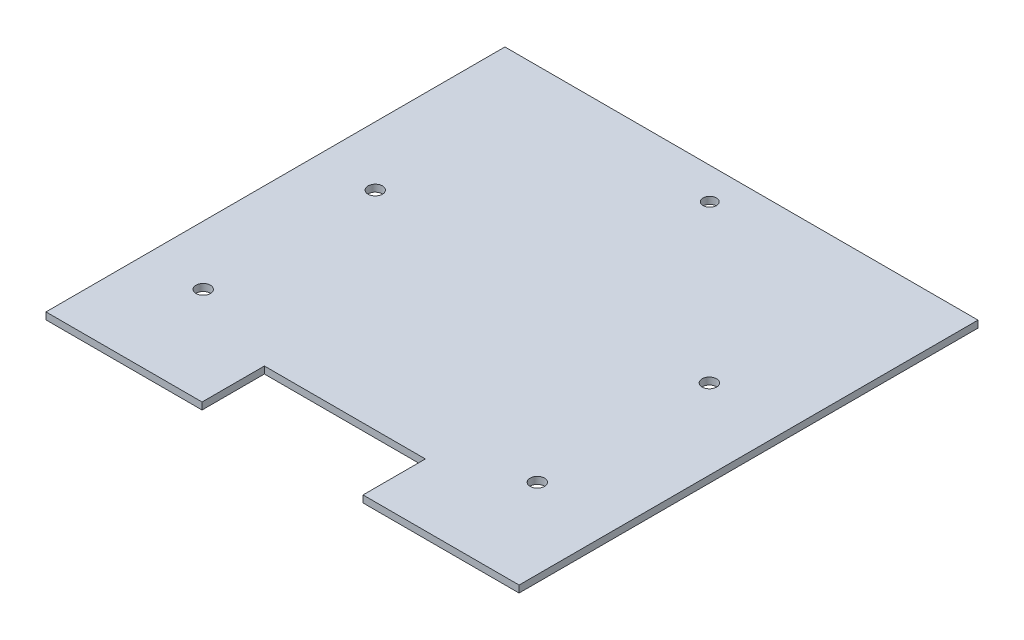
from build123d import *

# Parameters (mm, degrees)
SKETCH1_W           = 189.738
SKETCH1_H           = 184.05
BOSS_EXTRUDE1_DEPTH = 2.794
SKETCH2_R           = 2.6797
CUT_EXTRUDE1_DEPTH  = 133.198843497
CUT_EXTRUDE2_DEPTH  = 133.198843497
SKETCH4_R           = 2.893699953
CUT_EXTRUDE3_DEPTH  = 133.198843497


with BuildPart() as part:
    # Sketch1 → Boss-Extrude1 (new body)
    with BuildSketch(Plane(origin=(0, 0, 0), x_dir=(1, 0, 0), z_dir=(0, 1, 0))):
        Rectangle(SKETCH1_W, SKETCH1_H)
    extrude(amount=BOSS_EXTRUDE1_DEPTH)

    # Sketch2 → Cut-Extrude1 (cut, through all)
    with BuildSketch(Plane(origin=(0, 2.794, 0), x_dir=(1, 0, 0), z_dir=(0, 1, 0))):
        with Locations((0, 79.325)):
            Circle(SKETCH2_R)
    extrude(amount=-CUT_EXTRUDE1_DEPTH, mode=Mode.SUBTRACT)

    # Sketch3 → Cut-Extrude2 (cut, through all)
    with BuildSketch(Plane(origin=(0, 2.794, 0), x_dir=(1, 0, 0), z_dir=(0, 1, 0))):
        Polygon((0, -92.025), (-32.28, -92.025), (-32.28, -67.024999962), (32.28, -67.024999962), (32.28, -92.025), align=None)
    extrude(amount=-CUT_EXTRUDE2_DEPTH, mode=Mode.SUBTRACT)

    # Sketch4 → Cut-Extrude3 (cut, through all)
    with BuildSketch(Plane(origin=(0, 2.794, 0), x_dir=(1, 0, 0), z_dir=(0, 1, 0))):
        with Locations((-71.169, -52.674999962)):
            Circle(SKETCH4_R)
        with Locations((-71.169, 16.325000038)):
            Circle(SKETCH4_R)
        with Locations((62.831, 16.325000038)):
            Circle(SKETCH4_R)
        with Locations((62.831, -52.674999962)):
            Circle(SKETCH4_R)
    extrude(amount=-CUT_EXTRUDE3_DEPTH, mode=Mode.SUBTRACT)


solid = part.part
